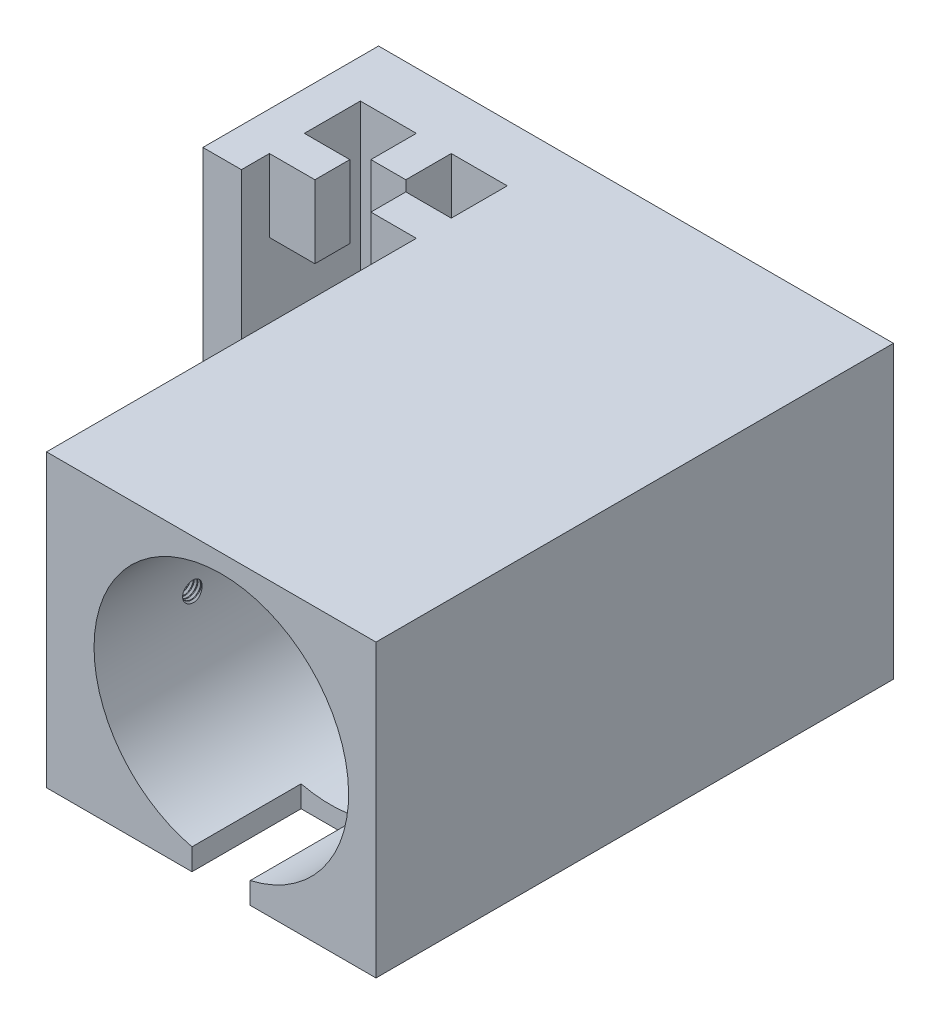
from build123d import *

# Parameters (mm, degrees)
BOSS_EXTRU_1_DEPTH                    = 20
ESQUISSE6_W                           = 20.2
ESQUISSE6_H                           = 20
ENL_V_MAT_EXTRU_1_DEPTH               = 3
ESQUISSE14_W                          = 30.8
ESQUISSE14_H                          = 2.5
BOSS_EXTRU_3_DEPTH                    = 40
CHANFREIN1_SIZE                       = 6.25
ESQUISSE16_W                          = 24.15
ESQUISSE16_H                          = 40
BOSS_EXTRU_4_DEPTH                    = 40
ESQUISSE18_W                          = 45.3
ESQUISSE18_H                          = 40
BOSS_EXTRU_5_DEPTH                    = 47
ESQUISSE17_R                          = 17.5
ENL_V_MAT_EXTRU_4_DEPTH               = 73
ESQUISSE19_W                          = 8
ESQUISSE19_H                          = 15
ENL_V_MAT_EXTRU_5_DEPTH               = 6
ESQUISSE22_R                          = 4
ENL_V_MAT_EXTRU_6_DEPTH               = 1
ESQUISSE23_R                          = 1.25
ENL_V_MAT_EXTRU_7_DEPTH               = 7
CHANFREIN4_SIZE                       = 0.25
ENL_VEMENT_DE_MATI_RE_BALAYAGE1_PITCH = 0.5


with BuildPart() as part:
    # Base → Boss.-Extru.1 (new, symmetric)
    with BuildSketch(Plane(origin=(0, 0, 0), x_dir=(1, 0, 0), z_dir=(0, 1, 0))):
        Polygon((-3.85, -2.4), (-3.85, 2.4), (-10.1, 2.4), (-10.1, 10.1), (-2.4, 10.1), (-2.4, 3.85), (2.4, 3.85), (2.4, 10.1), (10.1, 10.1), (10.1, 2.4), (3.85, 2.4), (3.85, -2.4), (10.1, -2.4), (10.1, -6.25), (15.4, -6.25), (15.4, 15.4), (-15.4, 15.4), (-15.4, -6.25), (-10.1, -6.25), (-10.1, -2.4), align=None)
    extrude(amount=BOSS_EXTRU_1_DEPTH, both=True)

    # Esquisse6 → Enlèv. mat.-Extru.1 (cut, symmetric)
    with BuildSketch(Plane.XY):
        Rectangle(ESQUISSE6_W, ESQUISSE6_H)
    extrude(amount=ENL_V_MAT_EXTRU_1_DEPTH, both=True, mode=Mode.SUBTRACT)

    # Esquisse14 → Boss.-Extru.3 (add)
    with BuildSketch(Plane.XZ.offset(20)):
        with Locations((0, -16.65)):
            Rectangle(ESQUISSE14_W, ESQUISSE14_H)
    extrude(amount=-BOSS_EXTRU_3_DEPTH)

    # Chanfrein1
    chanfrein1_edges = [part.edges().sort_by_distance(p)[0] for p in [
        (3.85, -10, 0),
        (-3.85, -10, 0),
    ]]
    chamfer(chanfrein1_edges, length=CHANFREIN1_SIZE - 0.0001)  # a hair under: the kernel refuses the full size

    # Esquisse16 → Boss.-Extru.4 (add)
    with BuildSketch(Plane(origin=(15.4, 0, 0), x_dir=(0, 0, -1), z_dir=(1, 0, 0))):
        with Locations((5.825, 0)):
            Rectangle(ESQUISSE16_W, ESQUISSE16_H)
    extrude(amount=BOSS_EXTRU_4_DEPTH)

    # Esquisse18 → Boss.-Extru.5 (add)
    with BuildSketch(Plane.XY.offset(6.25)):
        with Locations((32.75, 0)):
            Rectangle(ESQUISSE18_W, ESQUISSE18_H)
    extrude(amount=BOSS_EXTRU_5_DEPTH)

    # Esquisse17 → Enlèv. mat.-Extru.4 (cut)
    with BuildSketch(Plane(origin=(0, 0, -17.9), x_dir=(-1, 0, 0), z_dir=(0, 0, -1))):
        with Locations((-34.13383689, 0)):
            Circle(ESQUISSE17_R)
    extrude(amount=-ENL_V_MAT_EXTRU_4_DEPTH, mode=Mode.SUBTRACT)

    # Esquisse19 → Enlèv. mat.-Extru.5 (cut)
    with BuildSketch(Plane(origin=(0, -20, 0), x_dir=(-1, 0, 0), z_dir=(0, -1, 0))):
        with Locations((-34.1, -45.75)):
            Rectangle(ESQUISSE19_W, ESQUISSE19_H)
    extrude(amount=-ENL_V_MAT_EXTRU_5_DEPTH, mode=Mode.SUBTRACT)

    # Esquisse22 → Enlèv. mat.-Extru.6 (cut)
    with BuildSketch(Plane.ZY.offset(-10.1)):
        with Locations((39.697689273, 0)):
            Circle(ESQUISSE22_R)
    extrude(amount=-ENL_V_MAT_EXTRU_6_DEPTH, mode=Mode.SUBTRACT)

    # Esquisse23 → Enlèv. mat.-Extru.7 (cut)
    with BuildSketch(Plane.ZY.offset(-11.1)):
        with Locations((39.697689273, 0)):
            Circle(ESQUISSE23_R)
    extrude(amount=-ENL_V_MAT_EXTRU_7_DEPTH, mode=Mode.SUBTRACT)

    # Chanfrein4
    chanfrein4_edges = [part.edges().sort_by_distance(p)[0] for p in [
        (11.1, 0, 38.447689273),
    ]]
    chamfer(chanfrein4_edges, length=CHANFREIN4_SIZE)

    # Enlèvement de matière-Balayage1: arcs per turn and ends read off the stored shape
    # Enlèvement de matière-Balayage1: the profile of Esquisse55 screwed along a right-hand helix through 20 turns, 6 arcs to a turn; built about Z, then put on its axis
    enl_vement_de_mati_re_balayage1_z = Axis((0, 0, 0), (0, 0, 1))
    enl_vement_de_mati_re_balayage1_corners = [(1.24922135, 4.36e-07, -0.053702807), (1.24922135, 4.36e-07, -0.446297137), (1.49922135, 5.23e-07, -0.252782825)]
    with BuildLine(mode=Mode.PRIVATE) as enl_vement_de_mati_re_balayage1_profile:
        Line(enl_vement_de_mati_re_balayage1_corners[0], enl_vement_de_mati_re_balayage1_corners[1])
        Line(enl_vement_de_mati_re_balayage1_corners[1], enl_vement_de_mati_re_balayage1_corners[2])
        Line(enl_vement_de_mati_re_balayage1_corners[2], enl_vement_de_mati_re_balayage1_corners[0])
    enl_vement_de_mati_re_balayage1_cap = Face(enl_vement_de_mati_re_balayage1_profile.wire())
    enl_vement_de_mati_re_balayage1_turn_angles = [0, 30, 60, 90, 120, 150, 180, 210, 240, 270, 300, 330, 360]
    enl_vement_de_mati_re_balayage1_turn_weights = [1, 0.8660254037844387, 1, 0.8660254037844387, 1, 0.8660254037844387, 1, 0.8660254037844387, 1, 0.8660254037844387, 1, 0.8660254037844387, 1]
    enl_vement_de_mati_re_balayage1_turn_rails = [Edge.make_bspline([Vector(p[0], p[1], 0).rotate(enl_vement_de_mati_re_balayage1_z, enl_vement_de_mati_re_balayage1_turn_angles[k]) / enl_vement_de_mati_re_balayage1_turn_weights[k] + Vector(0, 0, p[2] + ENL_VEMENT_DE_MATI_RE_BALAYAGE1_PITCH * enl_vement_de_mati_re_balayage1_turn_angles[k] / 360) for k in range(13)], [0, 0, 0, 1, 1, 2, 2, 3, 3, 4, 4, 5, 5, 6, 6, 6], 2, enl_vement_de_mati_re_balayage1_turn_weights) for p in enl_vement_de_mati_re_balayage1_corners]
    enl_vement_de_mati_re_balayage1_turn_sides = [Face.make_surface_from_curves(enl_vement_de_mati_re_balayage1_turn_rails[p[0]], enl_vement_de_mati_re_balayage1_turn_rails[p[1]]) for p in [(0, 1), (1, 2), (2, 0)]]
    enl_vement_de_mati_re_balayage1 = Plane(origin=(10.1, 0, 39.697689273), x_dir=(0, 0.707106781186547, -0.707106781186548), z_dir=(1, 0, 0)) * Solid(Shell([*[p.moved(Location((0, 0, ENL_VEMENT_DE_MATI_RE_BALAYAGE1_PITCH * i))) for i in range(20) for p in enl_vement_de_mati_re_balayage1_turn_sides], enl_vement_de_mati_re_balayage1_cap, enl_vement_de_mati_re_balayage1_cap.rotate(enl_vement_de_mati_re_balayage1_z, 7200).moved(Location((0, 0, ENL_VEMENT_DE_MATI_RE_BALAYAGE1_PITCH * 7200 / 360)))]))
    add(enl_vement_de_mati_re_balayage1, mode=Mode.SUBTRACT)


solid = part.part
